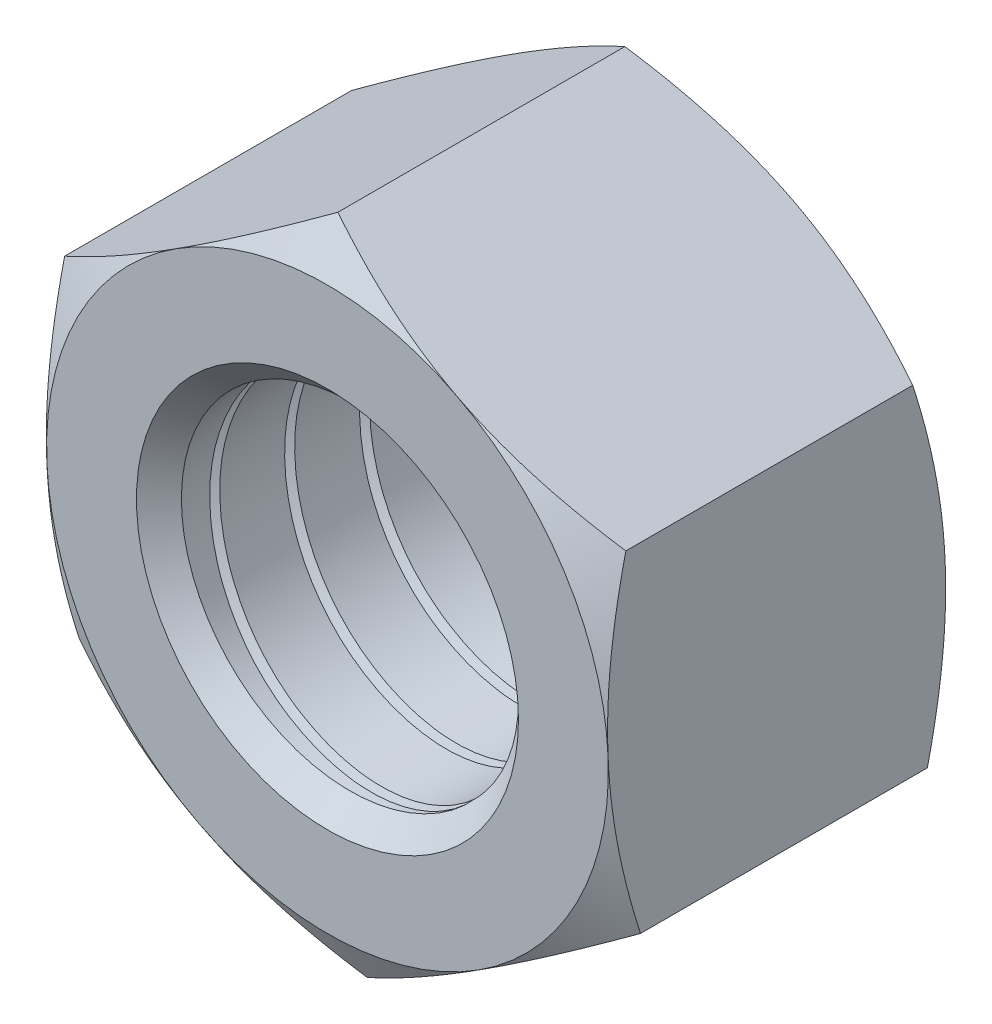
from build123d import *

# Parameters (mm, degrees)
BOSS_EXTRUDE1_DEPTH      = 1.5
BOSS_EXTRUDE1_DEPTH_BACK = 1.5
SKETCH2_OUTSIDE_W        = 13.978
SKETCH2_OUTSIDE_H        = 14.62
SKETCH2_OUTSIDE_R        = 2.5
CUT_EXTRUDE1_DEPTH       = 1.5
CUT_EXTRUDE1_DRAFT       = -60
MIRROR1_COPY_1_SKETCH_W  = 13.978
MIRROR1_COPY_1_SKETCH_H  = 14.62
MIRROR1_COPY_1_SKETCH_R  = 2.5
MIRROR1_COPY_1_DEPTH     = 1.5
MIRROR1_COPY_1_DRAFT     = -60
SKETCH3_R                = 1.5
CUT_EXTRUDE2_DEPTH       = 5.887029434
CHAMFER1_SIZE            = 0.2
CUT_SWEEP1_PITCH         = 0.666666667


with BuildPart() as part:
    # Sketch1 → Boss-Extrude1 (new, two sides: drawn at the far end of the back side and taken through both)
    with BuildSketch(Plane.XY.offset(-BOSS_EXTRUDE1_DEPTH_BACK)):
        Polygon((0.130191747, -2.883814044), (2.562552096, -1.329157662), (2.432360349, 1.554656382), (-0.130191747, 2.883814044), (-2.562552096, 1.329157662), (-2.432360349, -1.554656382), align=None)
    extrude(amount=BOSS_EXTRUDE1_DEPTH + BOSS_EXTRUDE1_DEPTH_BACK)


with BuildPart() as cut_extrude1_tool:
    # Sketch2 outside → Cut-Extrude1 (with draft: the straight prism first)
    with BuildSketch(Plane(origin=(0, 0, -1.5), x_dir=(-1, 0, 0), z_dir=(0, 0, -1))):
        Rectangle(SKETCH2_OUTSIDE_W, SKETCH2_OUTSIDE_H)
        Circle(SKETCH2_OUTSIDE_R, mode=Mode.SUBTRACT)
    extrude(amount=-CUT_EXTRUDE1_DEPTH)
    # Cut-Extrude1: the draft: its side faces are tilted about the plane it starts from
    cut_extrude1_sides = [cut_extrude1_tool.faces().sort_by_distance(p)[0] for p in [
        (0, -7.31, -0.75),
        (-6.989, 0, -0.75),
        (0, 7.31, -0.75),
        (6.989, 0, -0.75),
        (2.5, 0, -0.75),
    ]]
    draft(cut_extrude1_sides, Plane(origin=(0, 0, -1.5), x_dir=(-1, 0, 0), z_dir=(0, 0, -1)), CUT_EXTRUDE1_DRAFT)


with BuildPart() as part_1:
    add(part.part)

    # Cut-Extrude1: cut by cut_extrude1_tool
    add(cut_extrude1_tool.part, mode=Mode.SUBTRACT)


with BuildPart() as mirror1_copy_1_tool:
    # Mirror1 copy 1 sketch → Mirror1 copy 1 (with draft: the straight prism first)
    with BuildSketch(Plane(origin=(0, 0, 1.5), x_dir=(-1, 0, 0), z_dir=(0, 0, 1))):
        Rectangle(MIRROR1_COPY_1_SKETCH_W, MIRROR1_COPY_1_SKETCH_H)
        Circle(MIRROR1_COPY_1_SKETCH_R, mode=Mode.SUBTRACT)
    extrude(amount=-MIRROR1_COPY_1_DEPTH)
    # Mirror1 copy 1: the draft: its side faces are tilted about the plane it starts from
    mirror1_copy_1_sides = [mirror1_copy_1_tool.faces().sort_by_distance(p)[0] for p in [
        (0, -7.31, 0.75),
        (-6.989, 0, 0.75),
        (0, 7.31, 0.75),
        (6.989, 0, 0.75),
        (2.5, 0, 0.75),
    ]]
    draft(mirror1_copy_1_sides, Plane(origin=(0, 0, 1.5), x_dir=(-1, 0, 0), z_dir=(0, 0, 1)), MIRROR1_COPY_1_DRAFT)


with BuildPart() as part_2:
    add(part_1.part)

    # Mirror1 copy 1: cut by mirror1_copy_1_tool
    add(mirror1_copy_1_tool.part, mode=Mode.SUBTRACT)

    # Sketch3 → Cut-Extrude2 (cut, through all)
    with BuildSketch(Plane(origin=(0, 0, -1.5), x_dir=(-1, 0, 0), z_dir=(0, 0, -1))):
        Circle(SKETCH3_R)
    extrude(amount=-CUT_EXTRUDE2_DEPTH, mode=Mode.SUBTRACT)

    # Chamfer1
    chamfer1_edges = [part_2.edges().sort_by_distance(p)[0] for p in [
        (1.5, 0, 1.5),
        (1.5, 0, -1.5),
    ]]
    chamfer(chamfer1_edges, length=CHAMFER1_SIZE)

    # Cut-Sweep1: the profile of Sketch6 screwed along a right-hand helix of 7.5 turns, 6 arcs to a turn; built about Z, then put on its axis
    cut_sweep1_z = Axis((0, 0, 0), (0, 0, 1))
    cut_sweep1_corners = [(1.577350269, 0, -0.5), (0.711324865, 0, 0), (0.711324865, 0, -1)]
    with BuildLine(mode=Mode.PRIVATE) as cut_sweep1_profile:
        Line(cut_sweep1_corners[0], cut_sweep1_corners[1])
        Line(cut_sweep1_corners[1], cut_sweep1_corners[2])
        Line(cut_sweep1_corners[2], cut_sweep1_corners[0])
    cut_sweep1_cap = Face(cut_sweep1_profile.wire())
    cut_sweep1_turn_angles = [0, 30, 60, 90, 120, 150, 180, 210, 240, 270, 300, 330, 360]
    cut_sweep1_turn_weights = [1, 0.8660254037844387, 1, 0.8660254037844387, 1, 0.8660254037844387, 1, 0.8660254037844387, 1, 0.8660254037844387, 1, 0.8660254037844387, 1]
    cut_sweep1_turn_rails = [Edge.make_bspline([Vector(p[0], p[1], 0).rotate(cut_sweep1_z, cut_sweep1_turn_angles[k]) / cut_sweep1_turn_weights[k] + Vector(0, 0, p[2] + CUT_SWEEP1_PITCH * cut_sweep1_turn_angles[k] / 360) for k in range(13)], [0, 0, 0, 1, 1, 2, 2, 3, 3, 4, 4, 5, 5, 6, 6, 6], 2, cut_sweep1_turn_weights) for p in cut_sweep1_corners]
    cut_sweep1_turn_sides = [Face.make_surface_from_curves(cut_sweep1_turn_rails[p[0]], cut_sweep1_turn_rails[p[1]]) for p in [(0, 1), (1, 2), (2, 0)]]
    cut_sweep1_last_angles = [2520, 2550, 2580, 2610, 2640, 2670, 2700]
    cut_sweep1_last_weights = [1, 0.8660254037844387, 1, 0.8660254037844387, 1, 0.8660254037844446, 1]
    cut_sweep1_last_rails = [Edge.make_bspline([Vector(p[0], p[1], 0).rotate(cut_sweep1_z, cut_sweep1_last_angles[k]) / cut_sweep1_last_weights[k] + Vector(0, 0, p[2] + CUT_SWEEP1_PITCH * cut_sweep1_last_angles[k] / 360) for k in range(7)], [0, 0, 0, 1, 1, 2, 2, 3, 3, 3], 2, cut_sweep1_last_weights) for p in cut_sweep1_corners]
    cut_sweep1_last_sides = [Face.make_surface_from_curves(cut_sweep1_last_rails[p[0]], cut_sweep1_last_rails[p[1]]) for p in [(0, 1), (1, 2), (2, 0)]]
    cut_sweep1 = Plane(origin=(0, 0, 1.5), x_dir=(1, 0, 0), z_dir=(0, 0, -1)) * Solid(Shell([*[p.moved(Location((0, 0, CUT_SWEEP1_PITCH * i))) for i in range(7) for p in cut_sweep1_turn_sides], *cut_sweep1_last_sides, cut_sweep1_cap, cut_sweep1_cap.rotate(cut_sweep1_z, 2700).moved(Location((0, 0, CUT_SWEEP1_PITCH * 2700 / 360)))]))
    add(cut_sweep1, mode=Mode.SUBTRACT)


solid = part_2.part
